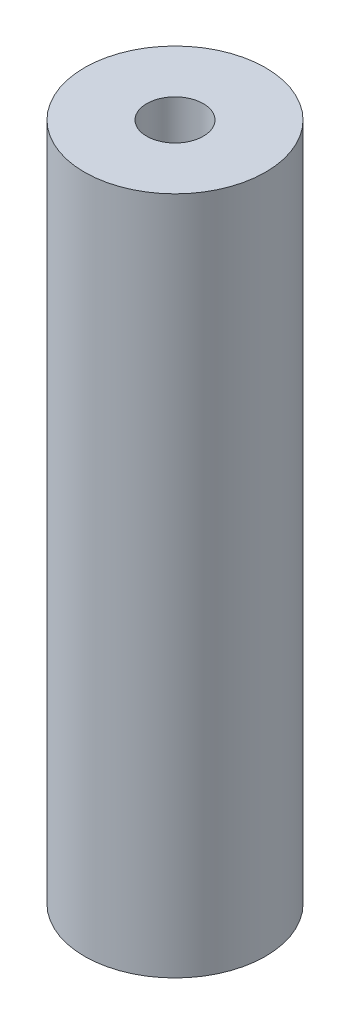
from build123d import *

# Parameters (mm, degrees)
SKETCH_1_R      = 4
EXTRUDE_1_DEPTH = 30
M3X0_51_D       = 2.5


with BuildPart() as part:
    # Эскиз1 → Бобышка-Вытянуть1 (new body)
    with BuildSketch(Plane(origin=(0, 0, 0), x_dir=(1, 0, 0), z_dir=(0, 1, 0))):
        Circle(SKETCH_1_R)
    extrude(amount=EXTRUDE_1_DEPTH)

    # Отверстие обработанное метчиком M3x0.51 (through all)
    with Locations(Plane(origin=(0, 0, 0), x_dir=(-1, 0, 0), z_dir=(0, -1, 0))):
        with Locations((0, 0)):
            Hole(M3X0_51_D / 2)


solid = part.part
